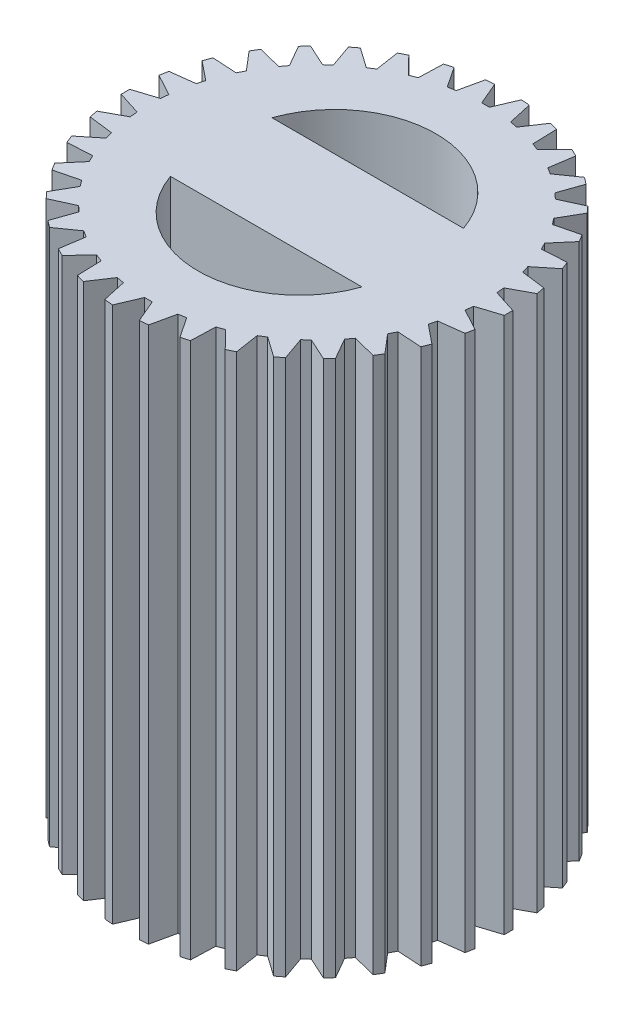
from build123d import *

# Parameters (mm, degrees)
BOSS_EXTRUDE2_DEPTH = 70
SKETCH3_R           = 4
CUT_EXTRUDE1_DEPTH  = 10
SKETCH4_R           = 0.5
CUT_EXTRUDE2_DEPTH  = 10
CIRPATTERN1_COUNT   = 2
CUT_EXTRUDE3_DEPTH  = 79.402407488


# Read off the part's stored shape, not the designer's step: Boss-Extrude2
with BuildPart() as part:
    # Boss-Extrude2 outline → Boss-Extrude2 (new body)
    with BuildSketch(Plane(origin=(0, 0, 0), x_dir=(1, 0, 0), z_dir=(0, 1, 0))):
        with BuildLine():
            Line((1.75, 24.938674784), (0.5, 22))
            Line((0.5, 22), (-0.5, 22))
            Line((-0.5, 22), (-1.75, 24.938674784))
            ThreePointArc((-1.75, 24.938674784), (-2.306708986, 24.893354407), (-2.862266542, 24.835608111))
            Line((-2.862266542, 24.835608111), (-3.551002842, 21.717282952))
            Line((-3.551002842, 21.717282952), (-4.533975942, 21.533533434))
            Line((-4.533975942, 21.533533434), (-6.302672391, 24.192484799))
            ThreePointArc((-6.302672391, 24.192484799), (-6.841574752, 24.045641079), (-7.37706203, 23.88679459))
            Line((-7.37706203, 23.88679459), (-7.481080541, 20.69500988))
            Line((-7.481080541, 20.69500988), (-8.413552771, 20.333768214))
            Line((-8.413552771, 20.333768214), (-10.640714833, 22.622448759))
            ThreePointArc((-10.640714833, 22.622448759), (-11.143458894, 22.379082284), (-11.640640518, 22.124544929))
            Line((-11.640640518, 22.124544929), (-11.156399015, 18.967993067))
            Line((-11.156399015, 18.967993067), (-12.006616151, 18.441560905))
            Line((-12.006616151, 18.441560905), (-14.616400494, 20.282032359))
            ThreePointArc((-14.616400494, 20.282032359), (-15.065865909, 19.950430682), (-15.507810955, 19.608870426))
            Line((-15.507810955, 19.608870426), (-14.451799702, 16.595044001))
            Line((-14.451799702, 16.595044001), (-15.190808619, 15.921348357))
            Line((-15.190808619, 15.921348357), (-18.094342166, 17.250935673))
            ThreePointArc((-18.094342166, 17.250935673), (-18.475222931, 16.842391091), (-18.84688149, 16.425439358))
            Line((-18.84688149, 16.425439358), (-17.255061682, 13.656970614))
            Line((-17.255061682, 13.656970614), (-17.857696318, 12.858953387))
            Line((-17.857696318, 12.858953387), (-20.956102717, 13.632379063))
            ThreePointArc((-20.956102717, 13.632379063), (-21.255428393, 13.160804072), (-21.544144079, 12.682659653))
            Line((-21.544144079, 12.682659653), (-19.470723232, 10.253825473))
            Line((-19.470723232, 10.253825473), (-19.916461588, 9.358662181))
            Line((-19.916461588, 9.358662181), (-23.104228325, 9.549588134))
            ThreePointArc((-23.104228325, 9.549588134), (-23.311805735, 9.031041654), (-23.507746682, 8.507987185))
            Line((-23.507746682, 8.507987185), (-21.023332655, 6.501498603))
            Line((-21.023332655, 6.501498603), (-21.296995645, 5.53967296))
            Line((-21.296995645, 5.53967296), (-24.465567147, 5.141597434))
            ThreePointArc((-24.465567147, 5.141597434), (-24.574327492, 4.593737945), (-24.670821165, 4.043585418))
            Line((-24.670821165, 4.043585418), (-21.860017699, 2.527770996))
            Line((-21.860017699, 2.527770996), (-21.952286058, 1.53203682))
            Line((-21.952286058, 1.53203682), (-24.993760423, 0.558515801))
            ThreePointArc((-24.993760423, 0.558515801), (-25, 0), (-24.993760423, -0.558515801))
            Line((-24.993760423, -0.558515801), (-21.952286058, -1.53203682))
            Line((-21.952286058, -1.53203682), (-21.860017699, -2.527770996))
            Line((-21.860017699, -2.527770996), (-24.670821165, -4.043585418))
            ThreePointArc((-24.670821165, -4.043585418), (-24.574327492, -4.593737945), (-24.465567147, -5.141597434))
            Line((-24.465567147, -5.141597434), (-21.296995645, -5.53967296))
            Line((-21.296995645, -5.53967296), (-21.023332655, -6.501498603))
            Line((-21.023332655, -6.501498603), (-23.507746682, -8.507987185))
            ThreePointArc((-23.507746682, -8.507987185), (-23.311805735, -9.031041654), (-23.104228325, -9.549588134))
            Line((-23.104228325, -9.549588134), (-19.916461588, -9.358662181))
            Line((-19.916461588, -9.358662181), (-19.470723232, -10.253825473))
            Line((-19.470723232, -10.253825473), (-21.544144079, -12.682659654))
            ThreePointArc((-21.544144079, -12.682659654), (-21.255428393, -13.160804072), (-20.956102717, -13.632379063))
            Line((-20.956102717, -13.632379063), (-17.857696318, -12.858953387))
            Line((-17.857696318, -12.858953387), (-17.255061682, -13.656970614))
            Line((-17.255061682, -13.656970614), (-18.84688149, -16.425439358))
            ThreePointArc((-18.84688149, -16.425439358), (-18.475222931, -16.842391091), (-18.094342166, -17.250935673))
            Line((-18.094342166, -17.250935673), (-15.190808619, -15.921348357))
            Line((-15.190808619, -15.921348357), (-14.451799702, -16.595044001))
            Line((-14.451799702, -16.595044001), (-15.507810955, -19.608870426))
            ThreePointArc((-15.507810955, -19.608870426), (-15.065865909, -19.950430682), (-14.616400494, -20.282032359))
            Line((-14.616400494, -20.282032359), (-12.006616151, -18.441560905))
            Line((-12.006616151, -18.441560905), (-11.156399015, -18.967993067))
            Line((-11.156399015, -18.967993067), (-11.640640518, -22.124544929))
            ThreePointArc((-11.640640518, -22.124544929), (-11.143458894, -22.379082284), (-10.640714833, -22.622448759))
            Line((-10.640714833, -22.622448759), (-8.413552771, -20.333768214))
            Line((-8.413552771, -20.333768214), (-7.481080541, -20.69500988))
            Line((-7.481080541, -20.69500988), (-7.37706203, -23.88679459))
            ThreePointArc((-7.37706203, -23.88679459), (-6.841574752, -24.045641079), (-6.302672391, -24.192484799))
            Line((-6.302672391, -24.192484799), (-4.533975942, -21.533533434))
            Line((-4.533975942, -21.533533434), (-3.551002842, -21.717282952))
            Line((-3.551002842, -21.717282952), (-2.862266542, -24.835608111))
            ThreePointArc((-2.862266542, -24.835608111), (-2.306708986, -24.893354407), (-1.75, -24.938674784))
            Line((-1.75, -24.938674784), (-0.5, -22))
            Line((-0.5, -22), (0.5, -22))
            Line((0.5, -22), (1.75, -24.938674784))
            ThreePointArc((1.75, -24.938674784), (2.306708986, -24.893354407), (2.862266542, -24.835608111))
            Line((2.862266542, -24.835608111), (3.551002842, -21.717282952))
            Line((3.551002842, -21.717282952), (4.533975942, -21.533533434))
            Line((4.533975942, -21.533533434), (6.302672391, -24.192484799))
            ThreePointArc((6.302672391, -24.192484799), (6.841574752, -24.045641079), (7.37706203, -23.88679459))
            Line((7.37706203, -23.88679459), (7.481080541, -20.69500988))
            Line((7.481080541, -20.69500988), (8.413552771, -20.333768214))
            Line((8.413552771, -20.333768214), (10.640714833, -22.622448759))
            ThreePointArc((10.640714833, -22.622448759), (11.143458895, -22.379082284), (11.640640519, -22.124544929))
            Line((11.640640519, -22.124544929), (11.156399015, -18.967993067))
            Line((11.156399015, -18.967993067), (12.006616151, -18.441560905))
            Line((12.006616151, -18.441560905), (14.616400494, -20.282032359))
            ThreePointArc((14.616400494, -20.282032359), (15.065865909, -19.950430682), (15.507810955, -19.608870426))
            Line((15.507810955, -19.608870426), (14.451799702, -16.595044001))
            Line((14.451799702, -16.595044001), (15.190808619, -15.921348357))
            Line((15.190808619, -15.921348357), (18.094342166, -17.250935673))
            ThreePointArc((18.094342166, -17.250935673), (18.475222931, -16.842391091), (18.84688149, -16.425439358))
            Line((18.84688149, -16.425439358), (17.255061682, -13.656970614))
            Line((17.255061682, -13.656970614), (17.857696318, -12.858953387))
            Line((17.857696318, -12.858953387), (20.956102717, -13.632379063))
            ThreePointArc((20.956102717, -13.632379063), (21.255428393, -13.160804072), (21.544144079, -12.682659653))
            Line((21.544144079, -12.682659653), (19.470723232, -10.253825473))
            Line((19.470723232, -10.253825473), (19.916461588, -9.358662181))
            Line((19.916461588, -9.358662181), (23.104228325, -9.549588134))
            ThreePointArc((23.104228325, -9.549588134), (23.311805735, -9.031041654), (23.507746682, -8.507987185))
            Line((23.507746682, -8.507987185), (21.023332655, -6.501498603))
            Line((21.023332655, -6.501498603), (21.296995645, -5.53967296))
            Line((21.296995645, -5.53967296), (24.465567147, -5.141597434))
            ThreePointArc((24.465567147, -5.141597434), (24.574327492, -4.593737945), (24.670821165, -4.043585418))
            Line((24.670821165, -4.043585418), (21.860017699, -2.527770996))
            Line((21.860017699, -2.527770996), (21.952286058, -1.53203682))
            Line((21.952286058, -1.53203682), (24.993760423, -0.558515801))
            ThreePointArc((24.993760423, -0.558515801), (25, 0), (24.993760423, 0.558515801))
            Line((24.993760423, 0.558515801), (21.952286058, 1.53203682))
            Line((21.952286058, 1.53203682), (21.860017699, 2.527770996))
            Line((21.860017699, 2.527770996), (24.670821165, 4.043585418))
            ThreePointArc((24.670821165, 4.043585418), (24.574327492, 4.593737945), (24.465567147, 5.141597434))
            Line((24.465567147, 5.141597434), (21.296995645, 5.53967296))
            Line((21.296995645, 5.53967296), (21.023332655, 6.501498603))
            Line((21.023332655, 6.501498603), (23.507746682, 8.507987185))
            ThreePointArc((23.507746682, 8.507987185), (23.311805735, 9.031041654), (23.104228325, 9.549588134))
            Line((23.104228325, 9.549588134), (19.916461588, 9.358662181))
            Line((19.916461588, 9.358662181), (19.470723232, 10.253825473))
            Line((19.470723232, 10.253825473), (21.544144079, 12.682659653))
            ThreePointArc((21.544144079, 12.682659653), (21.255428393, 13.160804072), (20.956102717, 13.632379063))
            Line((20.956102717, 13.632379063), (17.857696318, 12.858953387))
            Line((17.857696318, 12.858953387), (17.255061682, 13.656970614))
            Line((17.255061682, 13.656970614), (18.84688149, 16.425439358))
            ThreePointArc((18.84688149, 16.425439358), (18.475222931, 16.842391091), (18.094342166, 17.250935673))
            Line((18.094342166, 17.250935673), (15.190808619, 15.921348357))
            Line((15.190808619, 15.921348357), (14.451799702, 16.595044001))
            Line((14.451799702, 16.595044001), (15.507810955, 19.608870426))
            ThreePointArc((15.507810955, 19.608870426), (15.065865909, 19.950430682), (14.616400494, 20.282032359))
            Line((14.616400494, 20.282032359), (12.006616151, 18.441560905))
            Line((12.006616151, 18.441560905), (11.156399015, 18.967993067))
            Line((11.156399015, 18.967993067), (11.640640518, 22.124544929))
            ThreePointArc((11.640640518, 22.124544929), (11.143458894, 22.379082284), (10.640714833, 22.622448759))
            Line((10.640714833, 22.622448759), (8.413552771, 20.333768214))
            Line((8.413552771, 20.333768214), (7.481080541, 20.69500988))
            Line((7.481080541, 20.69500988), (7.37706203, 23.88679459))
            ThreePointArc((7.37706203, 23.88679459), (6.841574752, 24.045641079), (6.302672391, 24.192484799))
            Line((6.302672391, 24.192484799), (4.533975942, 21.533533434))
            Line((4.533975942, 21.533533434), (3.551002842, 21.717282952))
            Line((3.551002842, 21.717282952), (2.862266542, 24.835608111))
            ThreePointArc((2.862266542, 24.835608111), (2.306708986, 24.893354407), (1.75, 24.938674784))
        make_face()
    extrude(amount=BOSS_EXTRUDE2_DEPTH)

    # Sketch3 → Cut-Extrude1 (cut)
    with BuildSketch(Plane.XZ):
        with Locations(Location((0, 0, 0), (0, 0, 270))):
            Circle(SKETCH3_R)
    extrude(amount=-CUT_EXTRUDE1_DEPTH, mode=Mode.SUBTRACT)

    # Sketch4 → Cut-Extrude2 (cut)
    with BuildSketch(Plane.XZ):
        with Locations(Location((-9.925, 0, 0), (0, 0, 270))):
            Circle(SKETCH4_R)
    cut_extrude2 = extrude(amount=-CUT_EXTRUDE2_DEPTH, mode=Mode.SUBTRACT)

    # CirPattern1: Cut-Extrude2 ×2 about axis
    cirpattern1_axis = Axis((0, 0, 0), (0, 1, 0))
    for i in range(1, CIRPATTERN1_COUNT):
        add(cut_extrude2.rotate(cirpattern1_axis, i * 360 / CIRPATTERN1_COUNT), mode=Mode.SUBTRACT)

    # Sketch5 → Cut-Extrude3 (cut, through all)
    with BuildSketch(Plane.XZ):
        with BuildLine():
            Line((-12.5, 6.623664739), (12.5, 6.623664739))
            ThreePointArc((12.5, 6.623664739), (0, 15.524722913), (-12.5, 6.623664739))
        make_face()
        with BuildLine():
            Line((12.5, -6.623664739), (-12.5, -6.623664739))
            ThreePointArc((-12.5, -6.623664739), (0, -15.524722913), (12.5, -6.623664739))
        make_face()
    extrude(amount=-CUT_EXTRUDE3_DEPTH, mode=Mode.SUBTRACT)


solid = part.part
